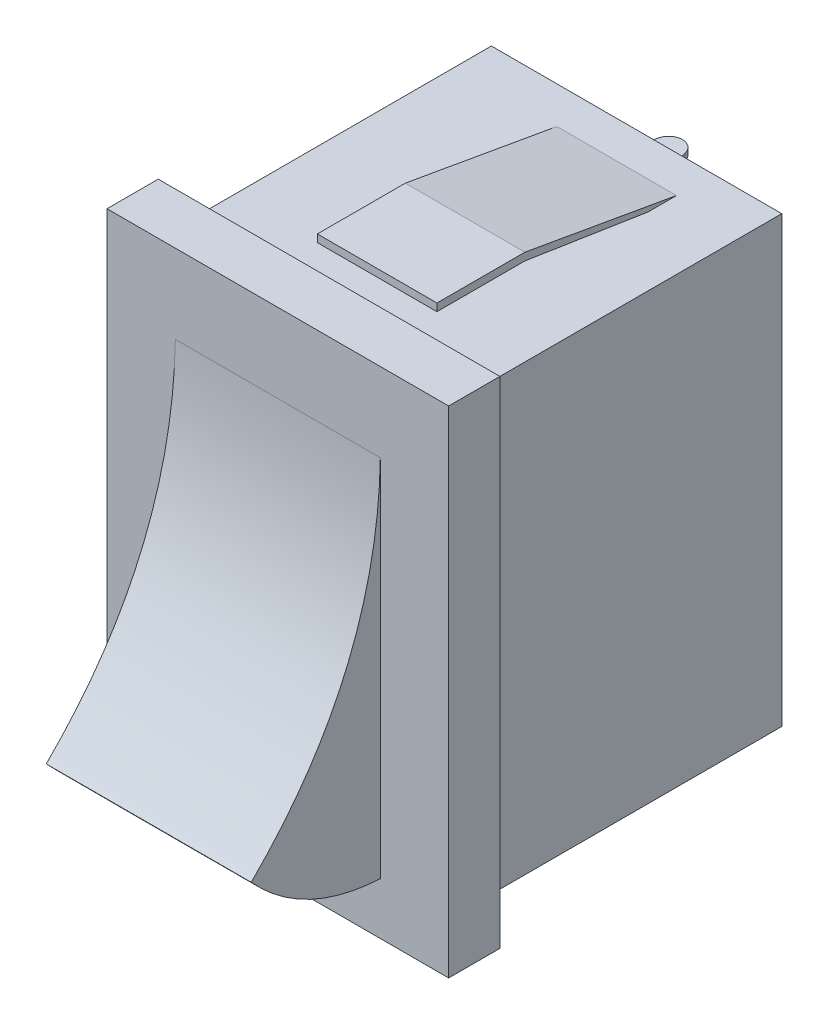
from build123d import *

# Parameters (mm, degrees)
SKETCH1_W               = 10
SKETCH1_H               = 14.5
BOSS_EXTRUDE1_DEPTH     = 1.5
SKETCH2_W               = 8.5
SKETCH2_H               = 13
BOSS_EXTRUDE2_DEPTH     = 9
SKETCH3_W               = 2.791946686
SKETCH3_H               = 1.078269065
SKETCH3_H_2             = 1.059014261
BOSS_EXTRUDE3_DEPTH     = 0.1
SKETCH4_W               = 1.827601408
SKETCH4_H               = 0.191898148
SKETCH4_H_2             = 0.191898147
BOSS_EXTRUDE4_DEPTH     = 2.5
CUT_EXTRUDE1_DEPTH      = 16.822021608
CUT_EXTRUDE2_DEPTH      = 16.708866747
CUT_EXTRUDE2_DEPTH_BACK = 16.708866747
BOSS_EXTRUDE5_DEPTH     = 3.5
BOSS_EXTRUDE6_DEPTH     = 6


with BuildPart() as part:
    # Sketch1 → Boss-Extrude1 (new body)
    with BuildSketch(Plane.XY):
        Rectangle(SKETCH1_W, SKETCH1_H)
    extrude(amount=BOSS_EXTRUDE1_DEPTH)

    # Sketch2 → Boss-Extrude2 (add)
    with BuildSketch(Plane(origin=(0, 0, 0), x_dir=(-1, 0, 0), z_dir=(0, 0, -1))):
        Rectangle(SKETCH2_W, SKETCH2_H)
    extrude(amount=BOSS_EXTRUDE2_DEPTH)

    # Sketch3 → Boss-Extrude3 (add)
    with BuildSketch(Plane(origin=(0, 0, -9), x_dir=(-1, 0, 0), z_dir=(0, 0, -1))):
        with Locations((1.184170491, 4.39009548)):
            Rectangle(SKETCH3_W, SKETCH3_H)
        with Locations((1.184170491, 2.300949166)):
            Rectangle(SKETCH3_W, SKETCH3_H_2)
    extrude(amount=BOSS_EXTRUDE3_DEPTH)

    # Sketch4 → Boss-Extrude4 (add)
    with BuildSketch(Plane(origin=(0, 0, -9.1), x_dir=(-1, 0, 0), z_dir=(0, 0, -1))):
        with Locations((1.158258605, 4.383973913)):
            Rectangle(SKETCH4_W, SKETCH4_H)
        with Locations((1.158258605, 2.373612365)):
            Rectangle(SKETCH4_W, SKETCH4_H_2)
    extrude(amount=BOSS_EXTRUDE4_DEPTH)

    # Sketch5 → Cut-Extrude1 (cut, through all)
    with BuildSketch(Plane.XZ.offset(-2.277663291)):
        with BuildLine():
            Line((-0.244457901, -9.1), (-0.716850813, -11.136852213))
            ThreePointArc((-0.716850813, -11.136852213), (-1.104869499, -11.44517919), (-1.492888184, -11.136852213))
            Line((-1.492888184, -11.136852213), (-2.072059309, -9.1))
            Line((-2.072059309, -9.1), (-2.072059309, -11.6))
            Line((-2.072059309, -11.6), (-0.244457901, -11.6))
            Line((-0.244457901, -11.6), (-0.244457901, -9.1))
        make_face()
    extrude(amount=-CUT_EXTRUDE1_DEPTH, mode=Mode.SUBTRACT)

    # Sketch6 → Cut-Extrude2 (cut, two sides: drawn at the far end of the back side and taken through both)
    with BuildSketch(Plane.XZ.offset(-2.277663291).offset(-CUT_EXTRUDE2_DEPTH_BACK)):
        with BuildLine():
            Line((-1.18611903, -10.920374874), (-1.18611903, -10.129628854))
            ThreePointArc((-1.18611903, -10.129628854), (-1.117358506, -10.060868331), (-1.048597983, -10.129628854))
            Line((-1.048597983, -10.129628854), (-1.048597983, -10.920374874))
            ThreePointArc((-1.048597983, -10.920374874), (-1.117358506, -10.989135398), (-1.18611903, -10.920374874))
        make_face()
    extrude(amount=CUT_EXTRUDE2_DEPTH + CUT_EXTRUDE2_DEPTH_BACK, mode=Mode.SUBTRACT)

    # Sketch7 → Boss-Extrude5 (add)
    with BuildSketch(Plane(origin=(2.25, 0, 0), x_dir=(0, 0, -1), z_dir=(1, 0, 0))):
        Polygon((7.918280304, 6.5), (3.481156502, 7.282461104), (0.907308887, 7.282461104), (0.907308887, 7.061394438), (3.481156502, 7.061394438), (7.081385067, 6.5), align=None)
    extrude(amount=-BOSS_EXTRUDE5_DEPTH)


with BuildPart() as body_2:
    # Sketch8 → Boss-Extrude6 (new body)
    with BuildSketch(Plane(origin=(3, 0, 0), x_dir=(0, 0, -1), z_dir=(1, 0, 0))):
        with BuildLine():
            add(Edge.make_bspline(
                [(-1.5, -5.733564241), (-3.759190449, -5.60540311), (-5.278855164, -3.934348818)],
                knots=[0, 0, 0, 1, 1, 1], degree=2))
            Line((-1.5, -5.733564241), (-1.5, 4.938044071))
            add(Edge.make_bspline(
                [(-5.278855164, -3.934348818), (-1.583424744, -0.285510331), (-1.5, 4.938044071)],
                knots=[0, 0, 0, 0.955846551, 0.955846551, 0.955846551], degree=2))
        make_face()
    extrude(amount=-BOSS_EXTRUDE6_DEPTH)


solid = Compound([part.part, body_2.part])
